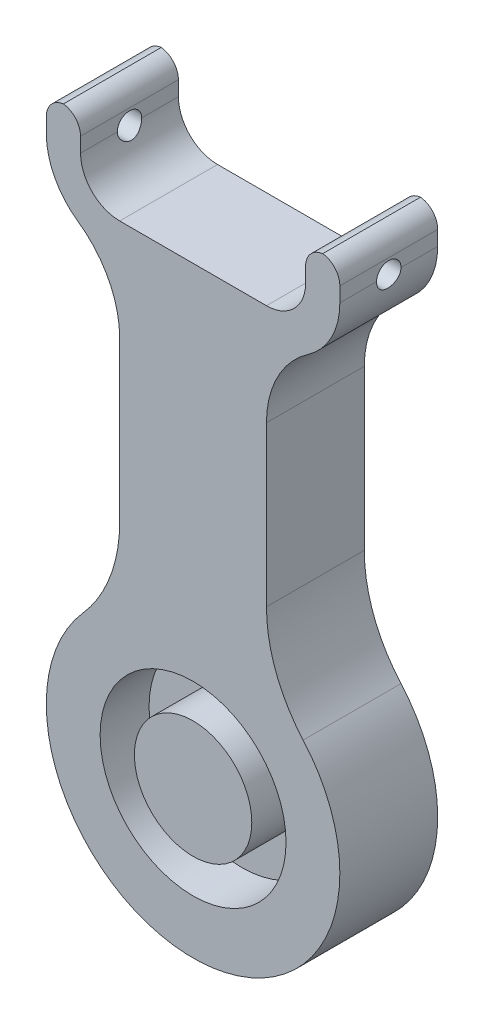
from build123d import *

# Parameters (mm, degrees)
SKETCH1_R               = 15
SKETCH1_R_2             = 3
BOSS_EXTRUDE1_DEPTH     = 10
SKETCH2_W               = 15
SKETCH2_H               = 30
BOSS_EXTRUDE2_DEPTH     = 10
FILLET1_R               = 15
SKETCH5_W               = 10
SKETCH5_H               = 2
BOSS_EXTRUDE3_DEPTH     = 10
BOSS_EXTRUDE4_START     = -3
SKETCH7_R               = 3
BOSS_EXTRUDE4_DEPTH     = 3
CHAMFER1_SIZE           = 0.7
BOSS_EXTRUDE6_DEPTH     = 10
FILLET4_R               = 2
FILLET2_R               = 10
CUT_EXTRUDE1_DEPTH      = 63.556116013
CUT_EXTRUDE1_DEPTH_BACK = 63.556116013
SKETCH10_R              = 1.25
SKETCH11_R              = 9.5
SKETCH11_R_2            = 6
CUT_EXTRUDE2_DEPTH      = 5


with BuildPart() as part:
    # Sketch1 → Boss-Extrude1 (new body)
    with BuildSketch(Plane.XY):
        Circle(SKETCH1_R)
        Circle(SKETCH1_R_2, mode=Mode.SUBTRACT)
    extrude(amount=BOSS_EXTRUDE1_DEPTH)

    # Sketch2 → Boss-Extrude2 (add)
    with BuildSketch(Plane.XY):
        with Locations((0, 27.990381057)):
            Rectangle(SKETCH2_W, SKETCH2_H)
    extrude(amount=BOSS_EXTRUDE2_DEPTH)

    # Fillet1
    fillet1_edges = [part.edges().sort_by_distance(p)[0] for p in [
        (-7.5, 12.990381057, 5),
        (7.5, 12.990381057, 5),
    ]]
    fillet(fillet1_edges, radius=FILLET1_R)

    # Sketch5 → Boss-Extrude3 (add)
    with BuildSketch(Plane(origin=(0, 0, 0), x_dir=(-1, 0, 0), z_dir=(0, 0, -1))):
        with Locations((0, 2.5)):
            Rectangle(SKETCH5_W, SKETCH5_H)
    extrude(amount=-BOSS_EXTRUDE3_DEPTH)

    # Sketch7 → Boss-Extrude4 (add)
    with BuildSketch(Plane.XY.offset(10).offset(BOSS_EXTRUDE4_START)):
        Circle(SKETCH7_R)
    extrude(amount=BOSS_EXTRUDE4_DEPTH)

    # Chamfer1
    chamfer1_edges = [part.edges().sort_by_distance(p)[0] for p in [
        (0, 1.5, 7),
        (0, -3, 7),
    ]]
    chamfer(chamfer1_edges, length=CHAMFER1_SIZE)

    # Sketch9 → Boss-Extrude6 (add)
    with BuildSketch(Plane(origin=(0, 0, 0), x_dir=(-1, 0, 0), z_dir=(0, 0, -1))):
        with BuildLine():
            Line((-15, 53.990381057), (-15, 50.490381057))
            ThreePointArc((-15, 50.490381057), (-12.803300859, 45.187080198), (-7.5, 42.990381057))
            Line((-7.5, 42.990381057), (0, 42.990381057))
            Line((0, 42.990381057), (0, 46.490381057))
            Line((0, 46.490381057), (-7.5, 46.490381057))
            ThreePointArc((-7.5, 46.490381057), (-10.328427125, 47.661953932), (-11.5, 50.490381057))
            Line((-11.5, 50.490381057), (-11.5, 53.990381057))
            Line((-11.5, 53.990381057), (-15, 53.990381057))
        make_face()
        with BuildLine():
            Line((0, 46.490381057), (0, 42.990381057))
            Line((0, 42.990381057), (7.5, 42.990381057))
            ThreePointArc((7.5, 42.990381057), (12.803300859, 45.187080198), (15, 50.490381057))
            Line((15, 50.490381057), (15, 53.990381057))
            Line((15, 53.990381057), (11.5, 53.990381057))
            Line((11.5, 53.990381057), (11.5, 50.490381057))
            ThreePointArc((11.5, 50.490381057), (10.328427125, 47.661953932), (7.5, 46.490381057))
            Line((7.5, 46.490381057), (0, 46.490381057))
        make_face()
    extrude(amount=-BOSS_EXTRUDE6_DEPTH)

    # Fillet4
    # the kernel refuses this fillet: 2 mm, written as the material it takes off along each edge
    with BuildSketch(Plane(origin=(11.5, 53.990381057, -5), x_dir=(0, -1, 0), z_dir=(0, 0, 1)), Plane(origin=(15, 53.990381057, -5), x_dir=(-1, 0, 0), z_dir=(0, 0, 1)), Plane(origin=(-11.5, 53.990381057, -5), x_dir=(-1, 0, 0), z_dir=(0, 0, 1)), Plane(origin=(-15, 53.990381057, -5), x_dir=(0, -1, 0), z_dir=(0, 0, 1))) as fillet4_piece_1:
        with BuildLine():
            CenterArc((FILLET4_R, FILLET4_R), FILLET4_R, 180, 90)
            Line((0, FILLET4_R), (0, 0))
            Line((0, 0), (FILLET4_R, 0))
        make_face()
    extrude(amount=20, mode=Mode.SUBTRACT)

    # Fillet2
    fillet2_edges = [part.edges().sort_by_distance(p)[0] for p in [
        (-7.5, 42.990381057, 5),
        (7.5, 42.990381057, 5),
    ]]
    fillet(fillet2_edges, radius=FILLET2_R)

    # Sketch10 → Cut-Extrude1 (cut, two sides: drawn at the far end of the back side and taken through both)
    with BuildSketch(Plane(origin=(15, 0, 0), x_dir=(0, 0, -1), z_dir=(1, 0, 0)).offset(-CUT_EXTRUDE1_DEPTH_BACK)):
        with Locations((-5, 50.490381057)):
            Circle(SKETCH10_R)
    extrude(amount=CUT_EXTRUDE1_DEPTH + CUT_EXTRUDE1_DEPTH_BACK, mode=Mode.SUBTRACT)

    # Sketch11 → Cut-Extrude2 (cut)
    with BuildSketch(Plane.XY.offset(10)):
        Circle(SKETCH11_R)
        Circle(SKETCH11_R_2, mode=Mode.SUBTRACT)
    extrude(amount=-CUT_EXTRUDE2_DEPTH, mode=Mode.SUBTRACT)


solid = part.part
